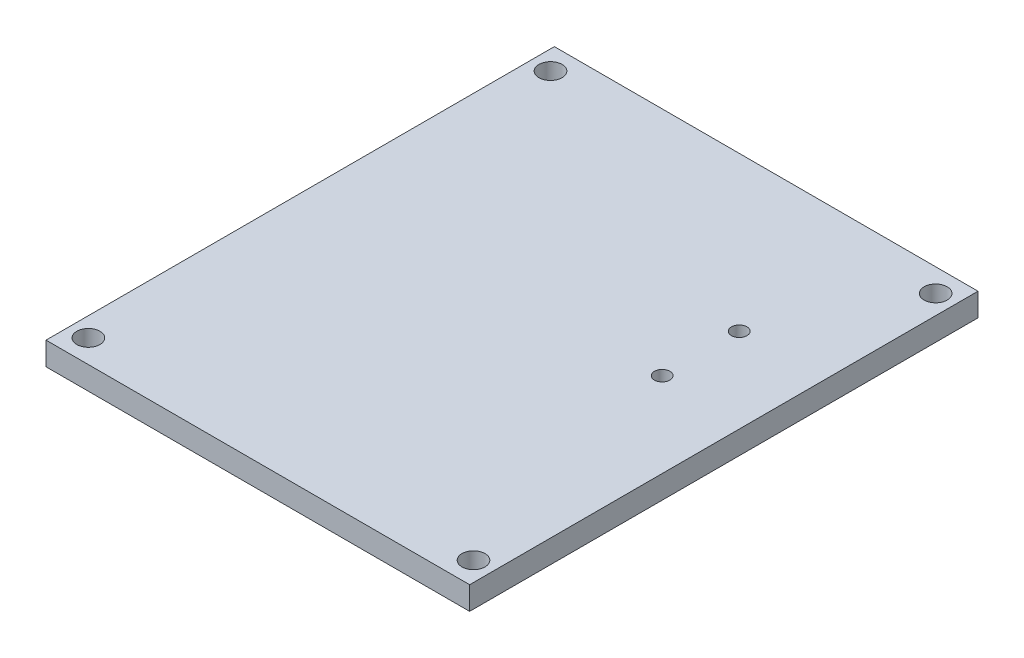
from build123d import *

# Parameters (mm, degrees)
ESQUISSE1_W        = 55
ESQUISSE1_H        = 66
ESQUISSE1_R        = 1.5
ESQUISSE1_R_2      = 1
BOSS_EXTRU_1_DEPTH = 3


with BuildPart() as part:
    # Esquisse1 → Boss.-Extru.1 (new body)
    with BuildSketch(Plane(origin=(0, 0, 0), x_dir=(1, 0, 0), z_dir=(0, 1, 0))):
        with Locations((-0.039557044, -0.082747187)):
            Rectangle(ESQUISSE1_W, ESQUISSE1_H)
        with Locations((-25.039557044, 29.917252813)):
            Circle(ESQUISSE1_R, mode=Mode.SUBTRACT)
        with Locations((24.960442956, 29.917252813)):
            Circle(ESQUISSE1_R, mode=Mode.SUBTRACT)
        with Locations((24.960442956, -30.082747187)):
            Circle(ESQUISSE1_R, mode=Mode.SUBTRACT)
        with Locations((-25.039557044, -30.082747187)):
            Circle(ESQUISSE1_R, mode=Mode.SUBTRACT)
        with Locations((16.460442956, 12.917252813)):
            Circle(ESQUISSE1_R_2, mode=Mode.SUBTRACT)
        with Locations((16.460442956, 2.917252813)):
            Circle(ESQUISSE1_R_2, mode=Mode.SUBTRACT)
    extrude(amount=BOSS_EXTRU_1_DEPTH)


solid = part.part
